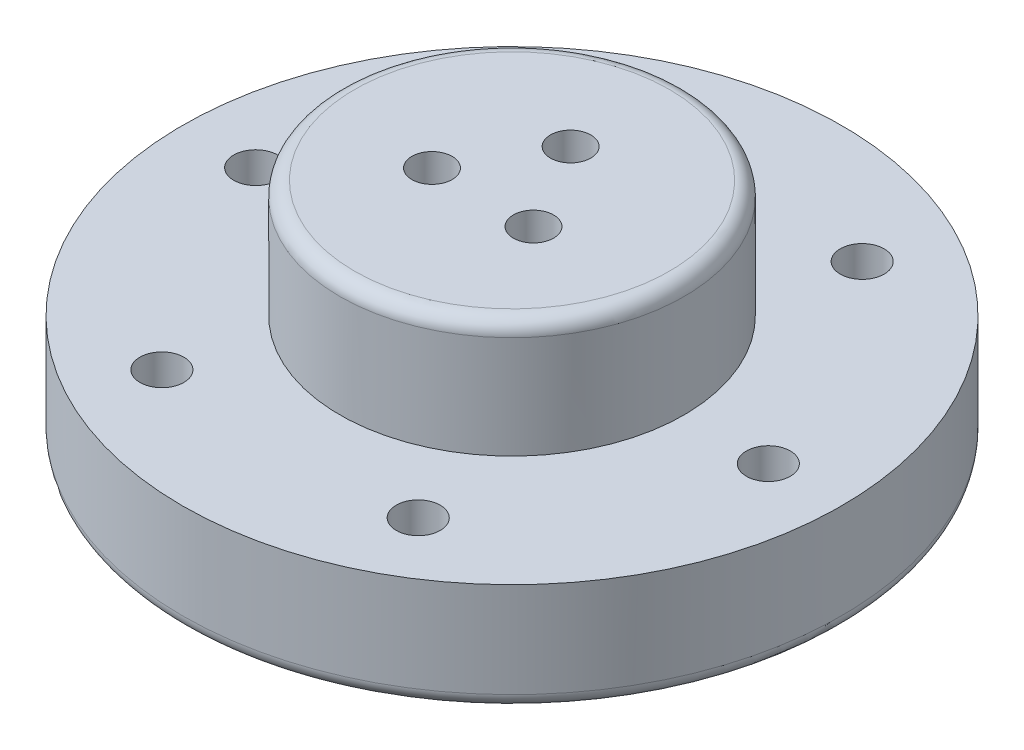
from build123d import *

# Parameters (mm, degrees)
SKETCH1_R           = 23.5
BOSS_EXTRUDE1_DEPTH = 14
SKETCH2_R           = 25
SKETCH2_R_2         = 21.05
BOSS_EXTRUDE2_DEPTH = 15
SKETCH3_R           = 5.65
SKETCH3_R_2         = 1.5
CUT_EXTRUDE1_DEPTH  = 7.5
SKETCH4_R           = 23.5
SKETCH4_R_2         = 1.517776155
SKETCH4_R_3         = 1.5
BOSS_EXTRUDE3_DEPTH = 2
SKETCH5_R           = 2.75
CUT_EXTRUDE2_DEPTH  = 6
SKETCH6_R           = 1.5
CUT_EXTRUDE3_DEPTH  = 42.907636536
CHAMFER1_SIZE       = 1.3
BOSS_EXTRUDE5_START = -15
SKETCH7_R           = 45
SKETCH7_R_2         = 3
SKETCH7_R_3         = 23.5
BOSS_EXTRUDE5_DEPTH = 15
FILLET1_R           = 2
FILLET2_R           = 1


# Some blends are built 0.0001 mm under size
with BuildPart() as part:
    # Sketch1 → Boss-Extrude1 (new body)
    with BuildSketch(Plane(origin=(0, 0, 0), x_dir=(1, 0, 0), z_dir=(0, 1, 0))):
        with Locations(Location((0, 0, 0), (0, 0, 270))):
            Circle(SKETCH1_R)
    extrude(amount=BOSS_EXTRUDE1_DEPTH)

    # Sketch2 → Boss-Extrude2 (add)
    with BuildSketch(Plane.XZ):
        with Locations(Location((0, 0, 0), (0, 0, 270))):
            Circle(SKETCH2_R)
        with Locations(Location((0, 0, 0), (0, 0, 270))):
            Circle(SKETCH2_R_2, mode=Mode.SUBTRACT)
    extrude(amount=BOSS_EXTRUDE2_DEPTH)

    # Sketch3 → Cut-Extrude1 (cut)
    with BuildSketch(Plane(origin=(0, 0, 0), x_dir=(-1, 0, 0), z_dir=(0, -1, 0))):
        with Locations(Location((0, 0, 0), (0, 0, 90))):
            Circle(SKETCH3_R)
        with Locations(Location((0, 8, 0), (0, 0, 90))):
            Circle(SKETCH3_R_2)
        with Locations(Location((6.92820323, -4, 0), (0, 0, 90))):
            Circle(SKETCH3_R_2)
        with Locations(Location((-6.92820323, -4, 0), (0, 0, 90))):
            Circle(SKETCH3_R_2)
    extrude(amount=-CUT_EXTRUDE1_DEPTH, mode=Mode.SUBTRACT)

    # Sketch4 → Boss-Extrude3 (add)
    with BuildSketch(Plane(origin=(0, 14, 0), x_dir=(1, 0, 0), z_dir=(0, 1, 0))):
        with Locations(Location((0, 0, 0), (0, 0, 90))):
            Circle(SKETCH4_R)
        with Locations(Location((0, 8, 0), (0, 0, 270))):
            Circle(SKETCH4_R_2, mode=Mode.SUBTRACT)
        with Locations(Location((6.92820323, -4, 0), (0, 0, 90))):
            Circle(SKETCH4_R_3, mode=Mode.SUBTRACT)
        with Locations(Location((-6.92820323, -4, 0), (0, 0, 90))):
            Circle(SKETCH4_R_3, mode=Mode.SUBTRACT)
    extrude(amount=BOSS_EXTRUDE3_DEPTH)

    # Sketch5 → Cut-Extrude2 (cut)
    with BuildSketch(Plane(origin=(0, 16, 0), x_dir=(1, 0, 0), z_dir=(0, 1, 0))):
        with Locations(Location((0, 8, 0), (0, 0, 270))):
            Circle(SKETCH5_R)
        with Locations(Location((6.92820323, -4, 0), (0, 0, 270))):
            Circle(SKETCH5_R)
        with Locations(Location((-6.92820323, -4, 0), (0, 0, 270))):
            Circle(SKETCH5_R)
    extrude(amount=-CUT_EXTRUDE2_DEPTH, mode=Mode.SUBTRACT)

    # Sketch6 → Cut-Extrude3 (cut, through all)
    with BuildSketch(Plane.XZ.offset(-7.5)):
        with Locations(Location((-6.92820323, 4, 0), (0, 0, 270))):
            Circle(SKETCH6_R)
        with Locations(Location((0, -8, 0), (0, 0, 270))):
            Circle(SKETCH6_R)
        with Locations(Location((6.92820323, 4, 0), (0, 0, 270))):
            Circle(SKETCH6_R)
    extrude(amount=-CUT_EXTRUDE3_DEPTH, mode=Mode.SUBTRACT)

    # Chamfer1
    # the kernel refuses this chamfer: 1.3 mm, written as the material it takes off along each edge
    with BuildSketch(Plane(origin=(0, 10, -8), x_dir=(0, 0, -1), z_dir=(-1, 0, 0))) as chamfer1_piece_1_section:
        Polygon((1.5 + CHAMFER1_SIZE, 0), (1.5, CHAMFER1_SIZE), (1.5, 0), align=None)
    chamfer1_piece_1 = revolve(axis=Axis((0, 10, -8), (0, -1, 0)), mode=Mode.PRIVATE)
    chamfer1_piece_1 = chamfer1_piece_1 & Plane(origin=(0, 9.322421141, -8), x_dir=(0, 0, 1), z_dir=(0, 1, 0)) * Cylinder(2.75, 12, mode=Mode.PRIVATE)
    add(chamfer1_piece_1, mode=Mode.SUBTRACT)
    with BuildSketch(Plane(origin=(-6.92820323, 10, 4), x_dir=(0, 0, -1), z_dir=(-1, 0, 0))) as chamfer1_piece_2_section:
        Polygon((1.5 + CHAMFER1_SIZE, 0), (1.5, CHAMFER1_SIZE), (1.5, 0), align=None)
    chamfer1_piece_2 = revolve(axis=Axis((-6.92820323, 10, 4), (0, -1, 0)), mode=Mode.PRIVATE)
    chamfer1_piece_2 = chamfer1_piece_2 & Plane(origin=(-6.92820323, 9.322421141, 4), x_dir=(0, 0, 1), z_dir=(0, 1, 0)) * Cylinder(2.75, 12, mode=Mode.PRIVATE)
    add(chamfer1_piece_2, mode=Mode.SUBTRACT)
    with BuildSketch(Plane(origin=(6.92820323, 10, 4), x_dir=(0, 0, -1), z_dir=(-1, 0, 0))) as chamfer1_piece_3_section:
        Polygon((1.5 + CHAMFER1_SIZE, 0), (1.5, CHAMFER1_SIZE), (1.5, 0), align=None)
    chamfer1_piece_3 = revolve(axis=Axis((6.92820323, 10, 4), (0, -1, 0)), mode=Mode.PRIVATE)
    chamfer1_piece_3 = chamfer1_piece_3 & Plane(origin=(6.92820323, 9.322421141, 4), x_dir=(0, 0, 1), z_dir=(0, 1, 0)) * Cylinder(2.75, 12, mode=Mode.PRIVATE)
    add(chamfer1_piece_3, mode=Mode.SUBTRACT)

    # Sketch7 → Boss-Extrude5 (add)
    with BuildSketch(Plane(origin=(0, 0, 0), x_dir=(1, 0, 0), z_dir=(0, 1, 0)).offset(BOSS_EXTRUDE5_START)):
        with Locations(Location((0, 0, 0), (0, 0, 270))):
            Circle(SKETCH7_R)
        with Locations(Location((-35, 0, 0), (0, 0, 270))):
            Circle(SKETCH7_R_2, mode=Mode.SUBTRACT)
        with Locations(Location((-17.4995, 30.311755158, 0), (0, 0, 270))):
            Circle(SKETCH7_R_2, mode=Mode.SUBTRACT)
        with Locations(Location((17.5015, 30.311755158, 0), (0, 0, 270))):
            Circle(SKETCH7_R_2, mode=Mode.SUBTRACT)
        with Locations(Location((35.002, 0, 0), (0, 0, 270))):
            Circle(SKETCH7_R_2, mode=Mode.SUBTRACT)
        with Locations(Location((17.5015, -30.311755158, 0), (0, 0, 270))):
            Circle(SKETCH7_R_2, mode=Mode.SUBTRACT)
        with Locations(Location((-17.4995, -30.311755158, 0), (0, 0, 270))):
            Circle(SKETCH7_R_2, mode=Mode.SUBTRACT)
        with Locations(Location((0, 0, 0), (0, 0, 90))):
            Circle(SKETCH7_R_3, mode=Mode.SUBTRACT)
    extrude(amount=BOSS_EXTRUDE5_DEPTH)

    # Fillet1
    fillet1_edges = [part.edges().sort_by_distance(p)[0] for p in [
        (0, 16, 23.5),
        (0, -15, -45),
    ]]
    fillet(fillet1_edges, radius=FILLET1_R - 0.0001)  # a hair under: the kernel refuses the full size

    # Fillet2
    fillet2_edges = [part.edges().sort_by_distance(p)[0] for p in [
        (0, -15, 21.05),
    ]]
    fillet(fillet2_edges, radius=FILLET2_R)


solid = part.part
